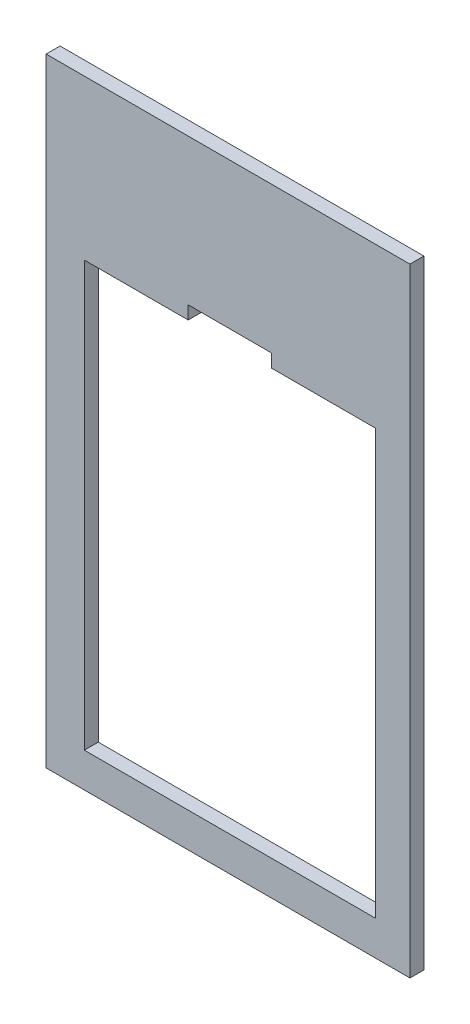
from build123d import *

# Parameters (mm, degrees)
BOSS_EXTRUDE1_DEPTH = 3.18
CUT_EXTRUDE1_DEPTH  = 82.82160381


with BuildPart() as part:
    # Sketch1 → Boss-Extrude1 (new body)
    with BuildSketch(Plane.XY):
        Polygon((-41.465, 70.465), (-13.821666667, 70.465), (13.821666667, 70.465), (41.465, 70.465), (41.465, -70.465), (-41.465, -70.465), align=None)
    extrude(amount=BOSS_EXTRUDE1_DEPTH)

    # Sketch3 → Cut-Extrude1 (cut, through all)
    with BuildSketch(Plane(origin=(0, 0, 0), x_dir=(-1, 0, 0), z_dir=(0, 0, -1))):
        Polygon((-9.92174207, 34.15325793), (-33.59674207, 34.15325793), (-33.59674207, -62.59674207), (32.75325793, -62.59674207), (32.75325793, 34.15325793), (9.07825793, 34.15325793), (9.07825793, 37.15325793), (-9.92174207, 37.15325793), align=None)
    extrude(amount=-CUT_EXTRUDE1_DEPTH, mode=Mode.SUBTRACT)


solid = part.part
